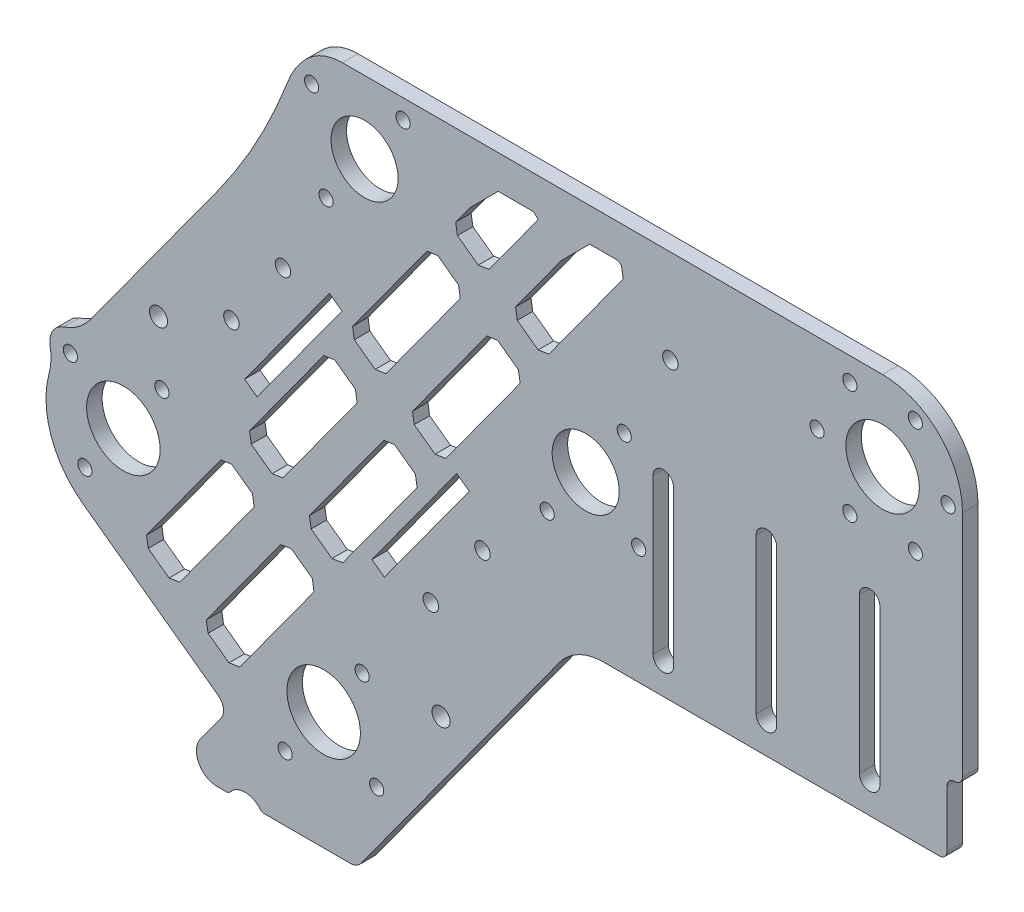
from build123d import *
from OCP.BRepFilletAPI import BRepFilletAPI_MakeChamfer

# Parameters (mm, degrees)
ESBO_O1_R                = 14.25
ESBO_O1_R_2              = 2.75
RESSALTO_EXTRUS_O1_DEPTH = 6
FILETE1_R                = 35
ESBO_O2_R                = 14.25
ESBO_O2_R_2              = 13.007181501
CORTE_EXTRUS_O1_DEPTH    = 395.288436253
RESSALTO_EXTRUS_O2_DEPTH = 6
FILETE2_R                = 220
FILETE3_R                = 20
CORTE_EXTRUS_O2_DEPTH    = 395.288436253
CORTE_EXTRUS_O3_DEPTH    = 395.288436253
FILETE4_R                = 21
FILETE5_R                = 21
RESSALTO_EXTRUS_O3_DEPTH = 6
FILETE6_R                = 8
FILETE7_R                = 5
ESBO_O9_R                = 7.5
CORTE_EXTRUS_O4_DEPTH    = 402.449745013
FILETE8_R                = 2
ESBO_O10_W               = 6
ESBO_O10_H               = 28
CORTE_EXTRUS_O5_DEPTH    = 402.449745013
FILETE9_R                = 3
CORTE_EXTRUS_O6_DEPTH    = 402.449745013
ESBO_O13_R               = 2.75
CORTE_EXTRUS_O7_DEPTH    = 402.449745013
ESBO_O14_R               = 8
ESBO_O14_R_2             = 2.75
RESSALTO_EXTRUS_O4_DEPTH = 6
FILETE10_R               = 21
RESSALTO_EXTRUS_O5_DEPTH = 6
CORTE_EXTRUS_O9_DEPTH    = 402.449745154
ESBO_O18_W               = 61.925338039
ESBO_O18_H               = 13
RESSALTO_EXTRUS_O6_DEPTH = 6
CHANFRO1_SIZE            = 3
CHANFRO1_SIZE2           = 13.560441064
CHANFRO1_SIZE2_2         = 2.147762868
CORTE_EXTRUS_O12_DEPTH   = 402.449745154
ESBO_O22_R               = 3.5
CORTE_EXTRUS_O13_DEPTH   = 10
ESBO_O24_R               = 3
CORTE_EXTRUS_O14_DEPTH   = 10
ESBO_O25_R               = 3
CORTE_EXTRUS_O15_DEPTH   = 402.449745154


with BuildPart() as part:
    # Esboço1 → Ressalto-extrusão1 (new body)
    with BuildSketch(Plane.XY):
        with BuildLine():
            Line((0, 31), (-209, 31))
            Line((-209, 31), (-338.312755504, -146.983738762))
            Line((-338.312755504, -146.983738762), (-232.308965955, -224))
            Line((-232.308965955, -224), (31, -224))
            Line((31, -224), (31, 0))
            ThreePointArc((31, 0), (21.920310217, 21.920310217), (0, 31))
        make_face()
        Circle(ESBO_O1_R, mode=Mode.SUBTRACT)
        with Locations((25.4, 0)):
            Circle(ESBO_O1_R_2, mode=Mode.SUBTRACT)
        with Locations((12.7, -21.997045256)):
            Circle(ESBO_O1_R_2, mode=Mode.SUBTRACT)
        with Locations((-12.7, -21.997045256)):
            Circle(ESBO_O1_R_2, mode=Mode.SUBTRACT)
        with Locations((-25.4, 0)):
            Circle(ESBO_O1_R_2, mode=Mode.SUBTRACT)
        with Locations((-12.7, 21.997045256)):
            Circle(ESBO_O1_R_2, mode=Mode.SUBTRACT)
        with Locations((12.7, 21.997045256)):
            Circle(ESBO_O1_R_2, mode=Mode.SUBTRACT)
    extrude(amount=RESSALTO_EXTRUS_O1_DEPTH)

    # Filete1
    filete1_edges = [part.edges().sort_by_distance(p)[0] for p in [
        (-338.312755504, -146.983738762, 3),
        (-209, 31, 3),
        (31, -224, 3),
        (-232.308965955, -224, 3),
    ]]
    fillet(filete1_edges, radius=FILETE1_R)

    # Esboço2 → Corte-extrusão1 (cut, through all)
    with BuildSketch(Plane.XY.offset(6)):
        with Locations((-294.405167611, -134.296821066)):
            Circle(ESBO_O2_R)
        with Locations((-216.739536151, -190.724205286)):
            Circle(ESBO_O2_R)
        with Locations((-200.877900702, 2.938926261)):
            Circle(ESBO_O2_R_2)
        with Locations((-115.122099298, -59.366310482)):
            Circle(ESBO_O2_R_2)
    extrude(amount=-CORTE_EXTRUS_O1_DEPTH, mode=Mode.SUBTRACT)

    # Esboço3 → Ressalto-extrusão2 (add, through all)
    with BuildSketch(Plane.XY.offset(6)):
        with BuildLine():
            ThreePointArc((-219.482204071, 16.57248383), (-207.056276759, 27.185228347), (-191.166609268, 31))
            Line((-191.166609268, 31), (-215.731810646, 31))
            ThreePointArc((-215.731810646, 31), (-229.079353938, 17.524553961), (-232.36272033, -1.156025875))
            Line((-232.36272033, -1.156025875), (-219.482204071, 16.57248383))
        make_face()
    extrude(amount=-RESSALTO_EXTRUS_O2_DEPTH)

    # Filete2
    filete2_edges = [part.edges().sort_by_distance(p)[0] for p in [
        (-232.36272033, -1.156025875, 3),
    ]]
    fillet(filete2_edges, radius=FILETE2_R)

    # Filete3
    filete3_edges = [part.edges().sort_by_distance(p)[0] for p in [
        (-215.731810646, 31, 3),
    ]]
    fillet(filete3_edges, radius=FILETE3_R)

    # Esboço4 → Corte-extrusão2 (cut, through all)
    with BuildSketch(Plane.XY.offset(6)):
        with BuildLine():
            Line((-176.970364037, -224), (-4, -224))
            ThreePointArc((-4, -224), (20.748737342, -213.748737342), (31, -189))
            Line((31, -189), (31, -119.672285429))
            ThreePointArc((31, -119.672285429), (-82.324586448, -153.218660801), (-176.970364037, -224))
        make_face()
    extrude(amount=-CORTE_EXTRUS_O2_DEPTH, mode=Mode.SUBTRACT)

    # Esboço6 → Corte-extrusão3 (cut, through all)
    with BuildSketch(Plane.XY.offset(6)):
        with BuildLine():
            Line((31, -119.672285429), (-119, -119.672285429))
            Line((-119, -119.672285429), (-194.798521486, -224))
            Line((-194.798521486, -224), (-176.970364037, -224))
            ThreePointArc((-176.970364037, -224), (-82.324586448, -153.218660801), (31, -119.672285429))
        make_face()
    extrude(amount=-CORTE_EXTRUS_O3_DEPTH, mode=Mode.SUBTRACT)

    # Filete4
    filete4_edges = [part.edges().sort_by_distance(p)[0] for p in [
        (-194.798521486, -224, 3),
    ]]
    fillet(filete4_edges, radius=FILETE4_R)

    # Filete5
    filete5_edges = [part.edges().sort_by_distance(p)[0] for p in [
        (-119, -119.672285429, 3),
    ]]
    fillet(filete5_edges, radius=FILETE5_R)

    # Esboço8 → Ressalto-extrusão3 (add, through all)
    with BuildSketch(Plane.XY.offset(6)):
        with BuildLine():
            Line((-188.509199043, -215.343490298), (-203.791615603, -236.377932152))
            Line((-203.791615603, -236.377932152), (-273.791615603, -236.377932152))
            Line((-273.791615603, -236.377932152), (-253.57365612, -208.55029825))
            ThreePointArc((-253.57365612, -208.55029825), (-220.763658416, -209.286451316), (-188.509199043, -215.343490298))
        make_face()
    extrude(amount=-RESSALTO_EXTRUS_O3_DEPTH)

    # Filete6
    filete6_edges = [part.edges().sort_by_distance(p)[0] for p in [
        (-273.791615603, -236.377932152, 3),
    ]]
    fillet(filete6_edges, radius=FILETE6_R)

    # Filete7
    filete7_edges = [part.edges().sort_by_distance(p)[0] for p in [
        (31, -119.672285429, 3),
        (-253.57365612, -208.55029825, 3),
        (-203.791615603, -236.377932152, 3),
    ]]
    fillet(filete7_edges, radius=FILETE7_R)

    # Esboço9 → Corte-extrusão4 (cut, through all)
    with BuildSketch(Plane.XY.offset(6)):
        with Locations((-247.193915604, -240.400560984)):
            Circle(ESBO_O9_R)
    extrude(amount=-CORTE_EXTRUS_O4_DEPTH, mode=Mode.SUBTRACT)

    # Filete8
    filete8_edges = [part.edges().sort_by_distance(p)[0] for p in [
        (-253.523880634, -236.377932152, 3),
        (-240.863950574, -236.377932152, 3),
    ]]
    fillet(filete8_edges, radius=FILETE8_R)

    # Esboço10 → Corte-extrusão5 (cut, through all)
    with BuildSketch(Plane.XY.offset(6)):
        with Locations((28, -105.672285429)):
            Rectangle(ESBO_O10_W, ESBO_O10_H)
    extrude(amount=-CORTE_EXTRUS_O5_DEPTH, mode=Mode.SUBTRACT)

    # Filete9
    filete9_edges = [part.edges().sort_by_distance(p)[0] for p in [
        (25, -119.672285429, 3),
        (25, -91.672285429, 3),
        (31, -91.672285429, 3),
    ]]
    fillet(filete9_edges, radius=FILETE9_R - 0.0001)  # a hair under: the kernel refuses the full size

    # Esboço11 → Corte-extrusão6 (cut, through all)
    with BuildSketch(Plane.XY.offset(6)):
        Polygon((-221.568679489, -162.494267727), (-141.629885178, -52.467956492), (-136.775783211, -55.994668006), (-216.714577523, -166.020979241), align=None)
        Polygon((-266.06461418, -130.166078851), (-186.125819868, -20.139767616), (-190.979921834, -16.613056102), (-270.918716146, -126.639367337), align=None)
    extrude(amount=-CORTE_EXTRUS_O6_DEPTH, mode=Mode.SUBTRACT)

    # Esboço13 → Corte-extrusão7 (cut, through all)
    with BuildSketch(Plane.XY.offset(6)):
        with Locations((-221.426932359, 17.86867167)):
            Circle(ESBO_O13_R)
        with Locations((-215.80764611, -17.610105396)):
            Circle(ESBO_O13_R)
        with Locations((-185.948155294, 23.487957919)):
            Circle(ESBO_O13_R)
        with Locations(Location((-130.051844706, -79.915342139, 0), (0, 0, 180))):
            Circle(ESBO_O13_R)
        with Locations(Location((-94.573067641, -74.29605589, 0), (0, 0, 180))):
            Circle(ESBO_O13_R)
        with Locations(Location((-100.19235389, -38.817278824, 0), (0, 0, 180))):
            Circle(ESBO_O13_R)
        with Locations((-314.954199268, -119.367075658)):
            Circle(ESBO_O13_R)
        with Locations((-279.475422202, -113.747789409)):
            Circle(ESBO_O13_R)
        with Locations((-309.334913019, -154.845852723)):
            Circle(ESBO_O13_R)
        with Locations(Location((-231.669281559, -211.273236943, 0), (0, 0, 180))):
            Circle(ESBO_O13_R)
        with Locations(Location((-196.190504493, -205.653950695, 0), (0, 0, 180))):
            Circle(ESBO_O13_R)
        with Locations(Location((-201.809790742, -170.175173629, 0), (0, 0, 180))):
            Circle(ESBO_O13_R)
    extrude(amount=-CORTE_EXTRUS_O7_DEPTH, mode=Mode.SUBTRACT)

    # Esboço14 → Ressalto-extrusão4 (add, through all)
    with BuildSketch(Plane.XY.offset(6)):
        with Locations((-314.954199268, -119.367075658)):
            Circle(ESBO_O14_R)
        with Locations((-314.954199268, -119.367075658)):
            Circle(ESBO_O14_R_2, mode=Mode.SUBTRACT)
    extrude(amount=-RESSALTO_EXTRUS_O4_DEPTH)

    # Filete10
    filete10_edges = [part.edges().sort_by_distance(p)[0] for p in [
        (-321.140839039, -124.43910566, 3),
        (-312.676327683, -111.698223003, 3),
    ]]
    fillet(filete10_edges, radius=FILETE10_R)

    # Esboço15 → Ressalto-extrusão5 (add, through all)
    with BuildSketch(Plane.XY.offset(6)):
        Polygon((-214.491331926, -48.973735877), (-190.979921834, -16.613056102), (-186.125819868, -20.139767616), (-209.63722996, -52.500447391), align=None)
        Polygon((-270.918716146, -126.639367337), (-247.407306055, -94.278687562), (-242.553204088, -97.805399076), (-266.06461418, -130.166078851), align=None)
        Polygon((-221.568679489, -162.494267727), (-198.057269398, -130.133587952), (-193.203167431, -133.660299466), (-216.714577523, -166.020979241), align=None)
        Polygon((-165.141295269, -84.828636267), (-141.629885178, -52.467956492), (-136.775783211, -55.994668006), (-160.287193303, -88.355347781), align=None)
    extrude(amount=-RESSALTO_EXTRUS_O5_DEPTH)

    # Esboço17 → Corte-extrusão9 (cut, through all)
    with BuildSketch(Plane.XY.offset(6)):
        Polygon((-287.215359825, -168.039286087), (-274.271087915, -177.443850123), (-241.942899039, -132.947915433), (-254.887170949, -123.543351396), align=None)
        Polygon((-263.996572086, -184.908722827), (-231.66838321, -140.412788137), (-218.7241113, -149.817352173), (-251.052300176, -194.313286864), align=None)
        Polygon((-224.02717493, -129.89556721), (-191.698986054, -85.399632519), (-178.754714144, -94.804196556), (-211.08290302, -139.300131247), align=None)
        Polygon((-247.245962669, -113.026130469), (-234.301690759, -122.430694506), (-201.973501883, -77.934759815), (-214.917773793, -68.530195778), align=None)
        Polygon((-184.057777774, -74.882411592), (-151.729588898, -30.386476902), (-138.785316988, -39.791040938), (-171.113505864, -84.286975629), align=None)
        Polygon((-207.276565513, -58.012974852), (-194.332293603, -67.417538888), (-162.004104727, -22.921604198), (-174.948376637, -13.517040161), align=None)
        Polygon((-144.088380618, -19.869255975), (-111.760191742, 24.626678716), (-98.815919832, 15.222114679), (-131.144108708, -29.273820012), align=None)
        Polygon((-167.307168357, -2.999819234), (-154.362896447, -12.404383271), (-122.034707571, 32.09155142), (-134.978979481, 41.496115457), align=None)
    extrude(amount=-CORTE_EXTRUS_O9_DEPTH, mode=Mode.SUBTRACT)

    # Esboço18 → Ressalto-extrusão6 (add, through all)
    with BuildSketch(Plane.XY.offset(6)):
        with Locations((-129.042176717, 24.5)):
            Rectangle(ESBO_O18_W, ESBO_O18_H)
    extrude(amount=-RESSALTO_EXTRUS_O6_DEPTH)

    # Chanfro1: one chamfer whose edges measure the first distance from different faces: ONE call of the kernel's chamfer builder (chamfer() names one face for all edges)
    chanfro1_edges_1 = [part.edges().sort_by_distance(p)[0] for p in [
        (-171.113505864, -84.286975629, 3),
        (-184.057777774, -74.882411592, 3),
        (-151.729588898, -30.386476902, 3),
        (-138.785316988, -39.791040938, 3),
        (-247.245962669, -113.026130469, 3),
        (-214.917773793, -68.530195778, 3),
        (-201.973501883, -77.934759815, 3),
        (-234.301690759, -122.430694506, 3),
        (-211.08290302, -139.300131247, 3),
        (-224.02717493, -129.89556721, 3),
        (-191.698986054, -85.399632519, 3),
        (-178.754714144, -94.804196556, 3),
        (-287.215359825, -168.039286087, 3),
        (-254.887170949, -123.543351396, 3),
        (-241.942899039, -132.947915433, 3),
        (-274.271087915, -177.443850123, 3),
        (-167.307168357, -2.999819234, 3),
        (-154.362896447, -12.404383271, 3),
        (-131.144108708, -29.273820012, 3),
        (-144.088380618, -19.869255975, 3),
        (-98.815919832, 15.222114679, 3),
        (-207.276565513, -58.012974852, 3),
        (-174.948376637, -13.517040161, 3),
        (-162.004104727, -22.921604198, 3),
        (-194.332293603, -67.417538888, 3),
        (-251.052300176, -194.313286864, 3),
        (-263.996572086, -184.908722827, 3),
        (-231.66838321, -140.412788137, 3),
        (-218.7241113, -149.817352173, 3),
    ]]
    chanfro1_edges_2 = [part.edges().sort_by_distance(p)[0] for p in [
        (-152.049906603, 18, 3),
    ]]
    chanfro1_side_2 = [part.faces().sort_by_distance(p)[0] for p in [
        (-142.161362783, 18, 3),
    ]]
    chanfro1_edges_3 = [part.edges().sort_by_distance(p)[0] for p in [
        (-132.272818963, 18, 3),
    ]]
    chanfro1_side_3 = [part.faces().sort_by_distance(p)[0] for p in [
        (-142.161362783, 18, 3),
    ]]
    chanfro1_edges_4 = [part.edges().sort_by_distance(p)[0] for p in [
        (-116.574755649, 18, 3),
    ]]
    chanfro1_side_4 = [part.faces().sort_by_distance(p)[0] for p in [
        (-109.607053307, 18, 3),
    ]]
    chanfro1 = BRepFilletAPI_MakeChamfer(part.part.solid().wrapped)
    for e in chanfro1_edges_1:
        chanfro1.Add(CHANFRO1_SIZE, e.wrapped)
    for e in chanfro1_edges_2:
        chanfro1.Add(CHANFRO1_SIZE, CHANFRO1_SIZE2, e.wrapped, chanfro1_side_2[0].wrapped)  # the first distance lies on this face
    for e in chanfro1_edges_3:
        chanfro1.Add(CHANFRO1_SIZE, CHANFRO1_SIZE2_2, e.wrapped, chanfro1_side_3[0].wrapped)  # the first distance lies on this face
    for e in chanfro1_edges_4:
        chanfro1.Add(CHANFRO1_SIZE, CHANFRO1_SIZE2, e.wrapped, chanfro1_side_4[0].wrapped)  # the first distance lies on this face
    add(Compound.cast(chanfro1.Shape()), mode=Mode.REPLACE)

    # Esboço21 → Corte-extrusão12 (cut, through all)
    with BuildSketch(Plane.XY.offset(6)):
        with BuildLine():
            Line((-1.048088309, -47.456747298), (-1.048088309, -107.456747298))
            ThreePointArc((-1.048088309, -107.456747298), (-5.048088309, -111.456747298), (-9.048088309, -107.456747298))
            Line((-9.048088309, -107.456747298), (-9.048088309, -47.456747298))
            ThreePointArc((-9.048088309, -47.456747298), (-5.048088309, -43.456747298), (-1.048088309, -47.456747298))
        make_face()
        with BuildLine():
            Line((-41.048088309, -47.456747298), (-41.048088309, -107.456747298))
            ThreePointArc((-41.048088309, -107.456747298), (-45.048088309, -111.456747298), (-49.048088309, -107.456747298))
            Line((-49.048088309, -107.456747298), (-49.048088309, -47.456747298))
            ThreePointArc((-49.048088309, -47.456747298), (-45.048088309, -43.456747298), (-41.048088309, -47.456747298))
        make_face()
        with BuildLine():
            Line((-81.048088309, -47.456747298), (-81.048088309, -107.456747298))
            ThreePointArc((-81.048088309, -107.456747298), (-85.048088309, -111.456747298), (-89.048088309, -107.456747298))
            Line((-89.048088309, -107.456747298), (-89.048088309, -47.456747298))
            ThreePointArc((-89.048088309, -47.456747298), (-85.048088309, -43.456747298), (-81.048088309, -47.456747298))
        make_face()
    extrude(amount=-CORTE_EXTRUS_O12_DEPTH, mode=Mode.SUBTRACT)

    # Esboço22 → Corte-extrusão13 (cut)
    with BuildSketch(Plane.XY.offset(6)):
        with Locations((-280.772714394, -89.903587492)):
            Circle(ESBO_O22_R)
        with Locations((-171.25246206, -169.474708491)):
            Circle(ESBO_O22_R)
    extrude(amount=-CORTE_EXTRUS_O13_DEPTH, mode=Mode.SUBTRACT)

    # Esboço24 → Corte-extrusão14 (cut)
    with BuildSketch(Plane.XY.offset(6)):
        with Locations((-232.525912721, -49.467593707)):
            Circle(ESBO_O24_R)
        with Locations((-252.510611299, -76.974171516)):
            Circle(ESBO_O24_R)
        with Locations((-175.168586637, -133.166441635)):
            Circle(ESBO_O24_R)
        with Locations((-155.183888059, -105.659863826)):
            Circle(ESBO_O24_R)
    extrude(amount=-CORTE_EXTRUS_O14_DEPTH, mode=Mode.SUBTRACT)

    # Esboço25 → Corte-extrusão15 (cut, through all)
    with BuildSketch(Plane.XY.offset(6)):
        with Locations((-82.298516774, -5.341756524)):
            Circle(ESBO_O25_R)
    extrude(amount=-CORTE_EXTRUS_O15_DEPTH, mode=Mode.SUBTRACT)


solid = part.part
